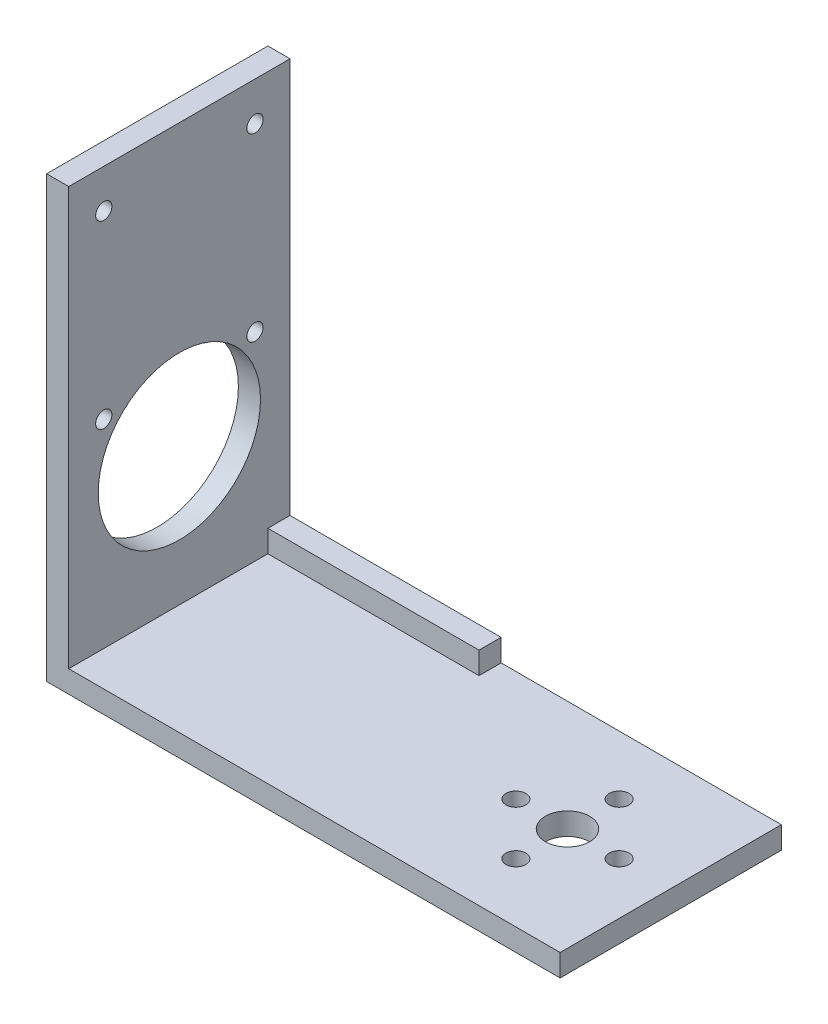
from build123d import *

# Parameters (mm, degrees)
S_BOX1_W      = 69.625
S_BOX1_H      = 3
BOSS_1_DEPTH  = 30
S_BOX2_W      = 3
S_BOX2_H      = 57.125
BOSS_2_DEPTH  = 30
S_BOX3_W      = 29.125
S_BOX3_H      = 3.5
BOSS_3_DEPTH  = 3
S_HOLE4_R     = 3
HOLE_4_DEPTH  = 3.2
S_HOLE5_R     = 1.35
HOLE_5_DEPTH  = 3.2
S_HOLE6_R     = 1.35
HOLE_6_DEPTH  = 3.2
S_HOLE7_R     = 1.35
HOLE_7_DEPTH  = 3.2
S_HOLE8_R     = 1.35
HOLE_8_DEPTH  = 3.2
S_HOLE9_R     = 11
HOLE_9_DEPTH  = 3.2
S_HOLE10_R    = 1.1
HOLE_10_DEPTH = 3.2
S_HOLE11_R    = 1.1
HOLE_11_DEPTH = 3.2
S_HOLE12_R    = 1.1
HOLE_12_DEPTH = 3.2
S_HOLE13_R    = 1.1
HOLE_13_DEPTH = 3.2


with BuildPart() as part:
    # S_box1 → Boss_1 (new body)
    with BuildSketch(Plane.XY.offset(-15)):
        with Locations((-20.8125, -20.125)):
            Rectangle(S_BOX1_W, S_BOX1_H)
    extrude(amount=BOSS_1_DEPTH)

    # S_box2 → Boss_2 (add)
    with BuildSketch(Plane.XY.offset(-15)):
        with Locations((-54.125, 9.4375)):
            Rectangle(S_BOX2_W, S_BOX2_H)
    extrude(amount=BOSS_2_DEPTH)

    # S_box3 → Boss_3 (add)
    with BuildSketch(Plane.XY.offset(-15)):
        with Locations((-38.5625, -17.375)):
            Rectangle(S_BOX3_W, S_BOX3_H)
    extrude(amount=BOSS_3_DEPTH)

    # S_hole4 → Hole_4 (cut)
    with BuildSketch(Plane(origin=(0, -21.725, 0), x_dir=(1, 0, 0), z_dir=(0, 1, 0))):
        Circle(S_HOLE4_R)
    extrude(amount=HOLE_4_DEPTH, mode=Mode.SUBTRACT)

    # S_hole5 → Hole_5 (cut)
    with BuildSketch(Plane(origin=(0, -21.725, 0), x_dir=(1, 0, 0), z_dir=(0, 1, 0))):
        with Locations((7, 0)):
            Circle(S_HOLE5_R)
    extrude(amount=HOLE_5_DEPTH, mode=Mode.SUBTRACT)

    # S_hole6 → Hole_6 (cut)
    with BuildSketch(Plane(origin=(0, -21.725, 0), x_dir=(1, 0, 0), z_dir=(0, 1, 0))):
        with Locations((0, -7)):
            Circle(S_HOLE6_R)
    extrude(amount=HOLE_6_DEPTH, mode=Mode.SUBTRACT)

    # S_hole7 → Hole_7 (cut)
    with BuildSketch(Plane(origin=(0, -21.725, 0), x_dir=(1, 0, 0), z_dir=(0, 1, 0))):
        with Locations((-7, 0)):
            Circle(S_HOLE7_R)
    extrude(amount=HOLE_7_DEPTH, mode=Mode.SUBTRACT)

    # S_hole8 → Hole_8 (cut)
    with BuildSketch(Plane(origin=(0, -21.725, 0), x_dir=(1, 0, 0), z_dir=(0, 1, 0))):
        with Locations((0, 7)):
            Circle(S_HOLE8_R)
    extrude(amount=HOLE_8_DEPTH, mode=Mode.SUBTRACT)

    # S_hole9 → Hole_9 (cut)
    with BuildSketch(Plane(origin=(-55.725, 0, 0), x_dir=(0, 0, -1), z_dir=(1, 0, 0))):
        Circle(S_HOLE9_R)
    extrude(amount=HOLE_9_DEPTH, mode=Mode.SUBTRACT)

    # S_hole10 → Hole_10 (cut)
    with BuildSketch(Plane(origin=(-55.725, 0, 0), x_dir=(0, 0, -1), z_dir=(1, 0, 0))):
        with Locations((10.25, 8.3)):
            Circle(S_HOLE10_R)
    extrude(amount=HOLE_10_DEPTH, mode=Mode.SUBTRACT)

    # S_hole11 → Hole_11 (cut)
    with BuildSketch(Plane(origin=(-55.725, 0, 0), x_dir=(0, 0, -1), z_dir=(1, 0, 0))):
        with Locations((-10.25, 8.3)):
            Circle(S_HOLE11_R)
    extrude(amount=HOLE_11_DEPTH, mode=Mode.SUBTRACT)

    # S_hole12 → Hole_12 (cut)
    with BuildSketch(Plane(origin=(-55.725, 0, 0), x_dir=(0, 0, -1), z_dir=(1, 0, 0))):
        with Locations((10.25, 32.75)):
            Circle(S_HOLE12_R)
    extrude(amount=HOLE_12_DEPTH, mode=Mode.SUBTRACT)

    # S_hole13 → Hole_13 (cut)
    with BuildSketch(Plane(origin=(-55.725, 0, 0), x_dir=(0, 0, -1), z_dir=(1, 0, 0))):
        with Locations((-10.25, 32.75)):
            Circle(S_HOLE13_R)
    extrude(amount=HOLE_13_DEPTH, mode=Mode.SUBTRACT)


solid = part.part
